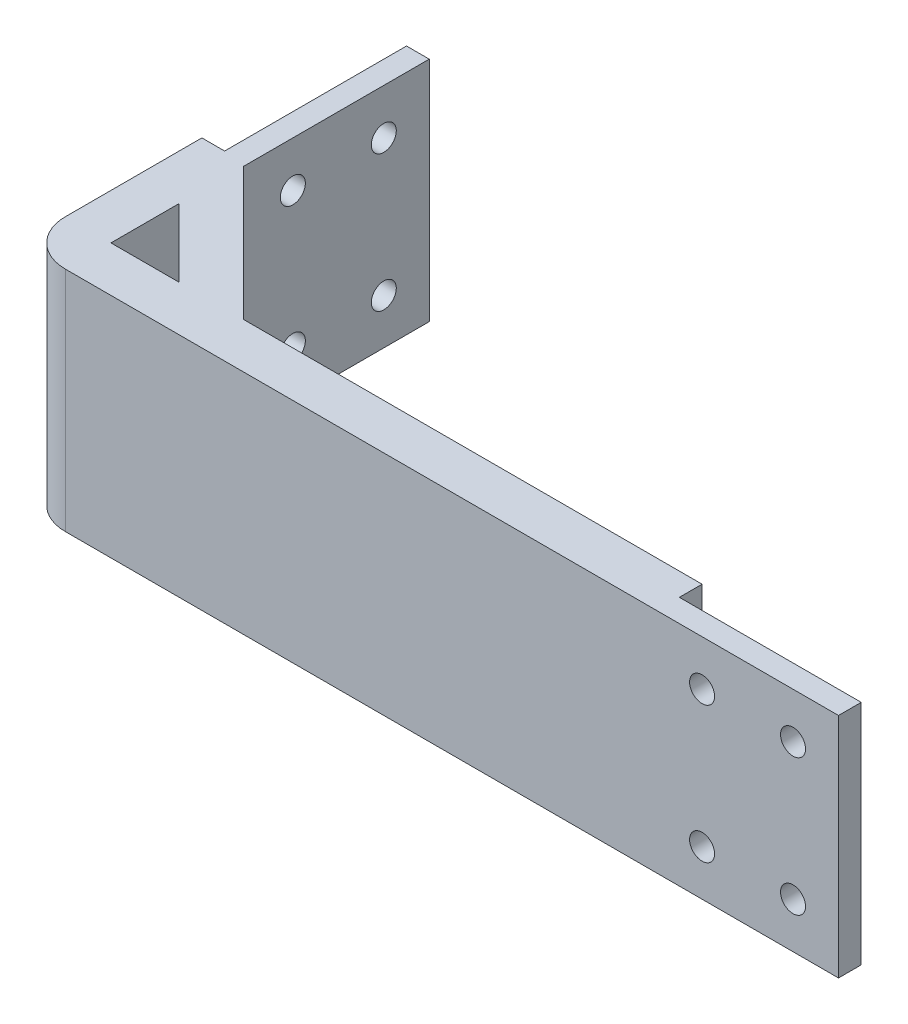
from build123d import *

# Parameters (mm, degrees)
BOSS_EXTRUDE1_DEPTH = 50
SKETCH3_W           = 40
SKETCH3_H           = 50
CUT_EXTRUDE1_DEPTH  = 5
SKETCH7_W           = 40
SKETCH7_H           = 50
CUT_EXTRUDE2_DEPTH  = 5
FILLET1_R           = 10


# Read off the part's stored shape, not the designer's step: M5 Clearance Hole1, M5 Clearance Hole2
with BuildPart() as part:
    # Sketch1 → Boss-Extrude1 (new body)
    with BuildSketch(Plane(origin=(0, 0, 0), x_dir=(1, 0, 0), z_dir=(0, 1, 0))):
        Polygon((10, 10), (10, 80), (0, 80), (0, 0), (180, 0), (180, 10), align=None)
        Polygon((39.142135624, 10), (10, 39.142135624), (10, 25), (25, 10), align=None)
    extrude(amount=BOSS_EXTRUDE1_DEPTH)

    # Sketch3 → Cut-Extrude1 (cut)
    with BuildSketch(Plane.XY.offset(-10)):
        with Locations((160, 25)):
            Rectangle(SKETCH3_W, SKETCH3_H)
    extrude(amount=CUT_EXTRUDE1_DEPTH, mode=Mode.SUBTRACT)

    # M5 Clearance Hole1 outline → M5 Clearance Hole1 (revolve, cut)
    with BuildSketch(Plane(origin=(170, 40, 0), x_dir=(1, 0, 0), z_dir=(0, -1, 0))):
        Polygon((2.75, -4.975), (2.75, 0), (0, 0), (0, -5), (2.775, -5), align=None)
    revolve(axis=Axis((170, 40, 0), (0, 0, 1)), mode=Mode.SUBTRACT)

    # M5 Clearance Hole1 2 outline → M5 Clearance Hole1 2 (revolve, cut)
    with BuildSketch(Plane(origin=(150, 40, 0), x_dir=(1, 0, 0), z_dir=(0, -1, 0))):
        Polygon((2.75, -4.975), (2.75, 0), (0, 0), (0, -5), (2.775, -5), align=None)
    revolve(axis=Axis((150, 40, 0), (0, 0, 1)), mode=Mode.SUBTRACT)

    # M5 Clearance Hole1 3 outline → M5 Clearance Hole1 3 (revolve, cut)
    with BuildSketch(Plane(origin=(150, 10, 0), x_dir=(1, 0, 0), z_dir=(0, -1, 0))):
        Polygon((2.75, -4.975), (2.75, 0), (0, 0), (0, -5), (2.775, -5), align=None)
    revolve(axis=Axis((150, 10, 0), (0, 0, 1)), mode=Mode.SUBTRACT)

    # M5 Clearance Hole1 4 outline → M5 Clearance Hole1 4 (revolve, cut)
    with BuildSketch(Plane(origin=(170, 10, 0), x_dir=(1, 0, 0), z_dir=(0, -1, 0))):
        Polygon((2.75, -4.975), (2.75, 0), (0, 0), (0, -5), (2.775, -5), align=None)
    revolve(axis=Axis((170, 10, 0), (0, 0, 1)), mode=Mode.SUBTRACT)

    # Sketch7 → Cut-Extrude2 (cut)
    with BuildSketch(Plane.ZY):
        with Locations((-60, 25)):
            Rectangle(SKETCH7_W, SKETCH7_H)
    extrude(amount=-CUT_EXTRUDE2_DEPTH, mode=Mode.SUBTRACT)

    # M5 Clearance Hole2 outline → M5 Clearance Hole2 (revolve, cut)
    with BuildSketch(Plane(origin=(0, 40, -70), x_dir=(0, 1, 0), z_dir=(0, 0, -1))):
        Polygon((2.75, 5.025), (2.75, 10), (0, 10), (0, 5), (2.775, 5), align=None)
    revolve(axis=Axis((0, 40, -70), (1, 0, 0)), mode=Mode.SUBTRACT)

    # M5 Clearance Hole2 2 outline → M5 Clearance Hole2 2 (revolve, cut)
    with BuildSketch(Plane(origin=(0, 10, -70), x_dir=(0, 1, 0), z_dir=(0, 0, -1))):
        Polygon((2.75, 5.025), (2.75, 10), (0, 10), (0, 5), (2.775, 5), align=None)
    revolve(axis=Axis((0, 10, -70), (1, 0, 0)), mode=Mode.SUBTRACT)

    # M5 Clearance Hole2 3 outline → M5 Clearance Hole2 3 (revolve, cut)
    with BuildSketch(Plane(origin=(0, 40, -50), x_dir=(0, 1, 0), z_dir=(0, 0, -1))):
        Polygon((2.75, 5.025), (2.75, 10), (0, 10), (0, 5), (2.775, 5), align=None)
    revolve(axis=Axis((0, 40, -50), (1, 0, 0)), mode=Mode.SUBTRACT)

    # M5 Clearance Hole2 4 outline → M5 Clearance Hole2 4 (revolve, cut)
    with BuildSketch(Plane(origin=(0, 10, -50), x_dir=(0, 1, 0), z_dir=(0, 0, -1))):
        Polygon((2.75, 5.025), (2.75, 10), (0, 10), (0, 5), (2.775, 5), align=None)
    revolve(axis=Axis((0, 10, -50), (1, 0, 0)), mode=Mode.SUBTRACT)

    # Fillet1
    fillet1_edges = [part.edges().sort_by_distance(p)[0] for p in [
        (0, 25, 0),
    ]]
    fillet(fillet1_edges, radius=FILLET1_R)


solid = part.part
